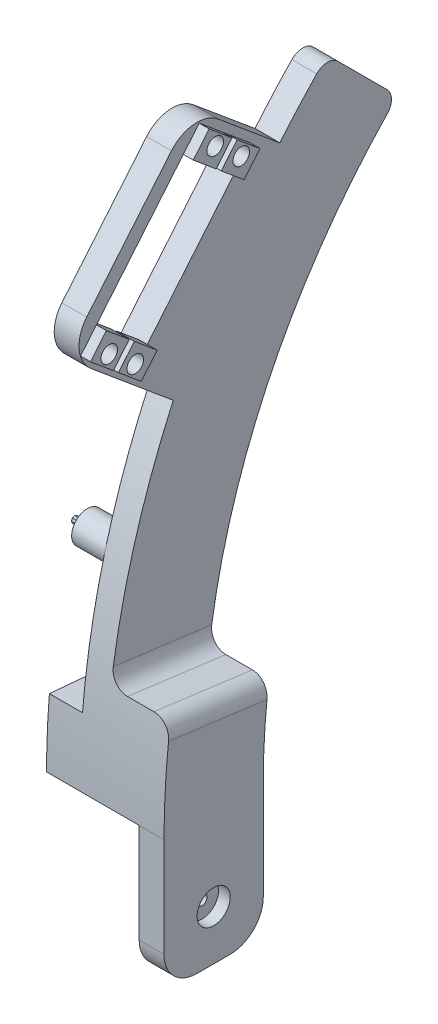
from build123d import *

# Parameters (mm, degrees)
CURVE_MAIN_BODY_DEPTH                = 35.5
CUT_EXTRUDE2_START                   = -18
CUT_EXTRUDE2_DEPTH                   = 18
CUT_EXTRUDE3_DEPTH                   = 10
FILLET3_R                            = 5
FILLET3_OF_MIRROR3_R                 = 5
SKETCH14_W                           = 7.5
SKETCH14_H                           = 30
BOSS_EXTRUDE9_DEPTH                  = 40
SKETCH17_R                           = 4.75
BOSS_EXTRUDE6_DEPTH                  = 20
SERVO_PLACEMENT_BODY_DEPTH           = 7.5
BOSS_EXTRUDE10_DEPTH                 = 27.5
CUT_EXTRUDE8_DEPTH                   = 211.213868042
CUT_EXTRUDE8_DEPTH_BACK              = 211.213868042
SKETCH29_W                           = 20
SKETCH29_H                           = 60
SKETCH21_W                           = 105.177079877
SKETCH21_H                           = 219.768987876
MAKE_HALF_DEPTH                      = 271.966391894
CHAMFER2_SIZE                        = 30
MALE_JACK_DEPTH                      = 4
MALE_JACK_CHAMFER_SIZE               = 0.2
SERVO_PLACEMENT_DEPTH                = 3
SKETCH36_R                           = 2.5
SERVO_HOLE_DEPTH                     = 270.745779446
SERVO_PLACEMENT_COMPLETION_DEPTH     = 5
BICEPS_CONNECTION_FILLET_R           = 10
BOW_CONNECTION_FILLET_R              = 4.5
SERVO_HOLE_FILLET_R                  = 10
SKETCH30_R                           = 4.5
FOREARM_SERVO_CONNECTION_OUTER_DEPTH = 2
SKETCH34_R                           = 1.5
FOREARM_SERVO_CONNECTION_INNER_DEPTH = 5.5
SKETCH38_R                           = 5
CUT_EXTRUDE14_DEPTH                  = 3.5
CUT_EXTRUDE15_DEPTH                  = 5


with BuildPart() as part:
    # Sketch2 → Curve Main Body (new body)
    with BuildSketch(Plane(origin=(0, 0, 0), x_dir=(0, 0, -1), z_dir=(1, 0, 0))):
        with BuildLine():
            Line((-197.17702304, 0), (-167.17702304, 0))
            ThreePointArc((-167.17702304, 0), (-151.952929542, 76.536686473), (-108.598379277, 141.421356237))
            Line((-108.598379277, 141.421356237), (-129.811582713, 162.634559673))
            ThreePointArc((-129.811582713, 162.634559673), (-179.669315518, 88.017189444), (-197.17702304, 0))
        make_face()
    curve_main_body = extrude(amount=CURVE_MAIN_BODY_DEPTH)

    # Sketch6 → Cut-Extrude2 (cut)
    with BuildSketch(Plane(origin=(35.5, 0, 0), x_dir=(0, 0, -1), z_dir=(1, 0, 0)).offset(CUT_EXTRUDE2_START)):
        with BuildLine():
            Line((-165.465995315, 26.105238444), (-195.209341156, 30.021024211))
            ThreePointArc((-195.209341156, 30.021024211), (-173.457753593, 101.72639875), (-129.811582713, 162.634559673))
            Line((-129.811582713, 162.634559673), (-108.598379277, 141.421356237))
            ThreePointArc((-108.598379277, 141.421356237), (-146.551571347, 88.457738044), (-165.465995315, 26.105238444))
        make_face()
    cut_extrude2 = extrude(amount=CUT_EXTRUDE2_DEPTH, mode=Mode.SUBTRACT)

    # Sketch7 → Cut-Extrude3 (cut)
    with BuildSketch(Plane.ZY):
        with BuildLine():
            Line((166.415962658, 17.43114855), (196.301803601, 20.045820832))
            ThreePointArc((196.301803601, 20.045820832), (175.627814058, 97.2022002), (129.811582713, 162.634559673))
            Line((129.811582713, 162.634559673), (108.598379277, 141.421356237))
            ThreePointArc((108.598379277, 141.421356237), (148.438580447, 84.523652348), (166.415962658, 17.43114855))
        make_face()
    cut_extrude3 = extrude(amount=-CUT_EXTRUDE3_DEPTH, mode=Mode.SUBTRACT)

    # Fillet3
    fillet3_edges = [part.edges().sort_by_distance(p)[0] for p in [
        (35.5, 28.063131327, 180.337668235),
        (17.5, 28.063131327, 180.337668235),
    ]]
    fillet(fillet3_edges, radius=FILLET3_R)

    # Mirror3: Curve Main Body, Cut-Extrude2, Cut-Extrude3 across plane
    add(curve_main_body.mirror(Plane(origin=(0, 0, -32.82297696), x_dir=(0, 0, 1), z_dir=(-1, 0, 0))))
    add(cut_extrude2.mirror(Plane(origin=(0, 0, -32.82297696), x_dir=(0, 0, 1), z_dir=(-1, 0, 0))), mode=Mode.SUBTRACT)
    add(cut_extrude3.mirror(Plane(origin=(0, 0, -32.82297696), x_dir=(0, 0, 1), z_dir=(-1, 0, 0))), mode=Mode.SUBTRACT)

    # Fillet3 of Mirror3
    fillet3_of_mirror3_edges = [part.edges().sort_by_distance(p)[0] for p in [
        (-35.5, 28.063131327, 180.337668235),
        (-17.5, 28.063131327, 180.337668235),
    ]]
    fillet(fillet3_of_mirror3_edges, radius=FILLET3_OF_MIRROR3_R)

    # Sketch14 → Boss-Extrude9 (add)
    with BuildSketch(Plane.XZ):
        with Locations((-31.75, 182.17702304)):
            Rectangle(SKETCH14_W, SKETCH14_H)
        with Locations((31.75, 182.17702304)):
            Rectangle(SKETCH14_W, SKETCH14_H)
    extrude(amount=BOSS_EXTRUDE9_DEPTH)

    # Sketch17 → Boss-Extrude6 (add)
    with BuildSketch(Plane(origin=(-10, 0, 0), x_dir=(0, 0, -1), z_dir=(1, 0, 0))):
        with Locations(Location((-115.276928512, 141.382391051, 0), (0, 0, 45))):
            Circle(SKETCH17_R)
        with Locations(Location((-184.833556277, 57.993068891, 0), (0, 0, 165.080977231))):
            Circle(SKETCH17_R)
    extrude(amount=BOSS_EXTRUDE6_DEPTH)

    # Sketch18 → Servo Placement Body (add)
    with BuildSketch(Plane(origin=(-10, 0, 0), x_dir=(0, 0, -1), z_dir=(1, 0, 0))):
        Polygon((-208.94151729, 122.761668275), (-162.866051375, 84.329241332), (-124.433624432, 130.404707247), (-170.509090347, 168.83713419), align=None)
    extrude(amount=-SERVO_PLACEMENT_BODY_DEPTH)

    # Sketch26 → Boss-Extrude10 (add)
    with BuildSketch(Plane(origin=(-10, 0, 0), x_dir=(0, 0, -1), z_dir=(1, 0, 0))):
        Polygon((-144.175864755, 146.872087312), (-170.509090347, 168.83713419), (-208.94151729, 122.761668275), (-176.370431585, 95.593503028), align=None)
    extrude(amount=BOSS_EXTRUDE10_DEPTH)

    # Sketch29 → Cut-Extrude8 (cut, two sides: drawn at the far end of the back side and taken through both)
    with BuildSketch(Plane(origin=(0, 153.143683779, 183.599297347), x_dir=(1, 0, 0), z_dir=(0, 0.640540449048381, 0.767924431915601)).offset(-CUT_EXTRUDE8_DEPTH_BACK)):
        with Locations((0, -9.563808939)):
            Rectangle(SKETCH29_W, SKETCH29_H)
    extrude(amount=CUT_EXTRUDE8_DEPTH + CUT_EXTRUDE8_DEPTH_BACK, mode=Mode.SUBTRACT)

    # Sketch21 → Make Half (cut, through all)
    with BuildSketch(Plane(origin=(0, 0, 0), x_dir=(0, 0, -1), z_dir=(1, 0, 0))):
        with Locations((-156.96960977, 61.310905927)):
            Rectangle(SKETCH21_W, SKETCH21_H)
    extrude(amount=-MAKE_HALF_DEPTH, mode=Mode.SUBTRACT)

    # Chamfer2
    # the kernel refuses this chamfer: 30, 19 mm, written as the material it takes off along each edge
    with BuildSketch(Plane(origin=(-77.551070811, 0, 167.17702304), x_dir=(0, 0, 1), z_dir=(1, 0, 0))) as chamfer2_piece_1:
        with BuildLine():
            Line((CHAMFER2_SIZE, 0), (-0.963738269, -19.610367571))
            ThreePointArc((-0.963738269, -19.610367571), (-0.258402539, -10.163377571), (0, 0))
            Line((0, 0), (CHAMFER2_SIZE, 0))
        make_face()
    extrude(amount=105.551070811, mode=Mode.SUBTRACT)

    # Sketch31 → Male Jack (add)
    with BuildSketch(Plane.ZY):
        Polygon((116.276928512, 141.382391051), (115.984035293, 142.089497832), (115.276928512, 142.382391051), (114.569821731, 142.089497832), (114.276928512, 141.382391051), (114.569821731, 140.675284269), (115.276928512, 140.382391051), (115.984035293, 140.675284269), align=None)
        Polygon((184.833556277, 58.993068891), (184.126449496, 58.700175672), (183.833556277, 57.993068891), (184.126449496, 57.285962109), (184.833556277, 56.993068891), (185.540663058, 57.285962109), (185.833556277, 57.993068891), (185.540663058, 58.700175672), align=None)
    extrude(amount=MALE_JACK_DEPTH)

    # Male Jack Chamfer
    male_jack_chamfer_edges = [part.edges().sort_by_distance(p)[0] for p in [
        (-4, 142.235944441, 115.630481903),
        (-4, 142.235944441, 114.923375121),
        (-4, 141.735944441, 114.423375121),
        (-4, 141.02883766, 114.423375121),
        (-4, 140.52883766, 114.923375121),
        (-4, 140.52883766, 115.630481903),
        (-4, 141.02883766, 116.130481903),
        (-4, 141.735944441, 116.130481903),
        (-4, 58.846622281, 185.187109667),
        (-4, 58.846622281, 184.480002886),
        (-4, 58.346622281, 183.980002886),
        (-4, 57.6395155, 183.980002886),
        (-4, 57.1395155, 184.480002886),
        (-4, 57.1395155, 185.187109667),
        (-4, 57.6395155, 185.687109667),
        (-4, 58.346622281, 185.687109667),
    ]]
    chamfer(male_jack_chamfer_edges, length=MALE_JACK_CHAMFER_SIZE)

    # Sketch35 → Servo Placement (add)
    with BuildSketch(Plane(origin=(17.5, 0, 0), x_dir=(0, 0, -1), z_dir=(1, 0, 0))):
        Polygon((-204.396938583, 121.184707789), (-189.038449945, 108.373898808), (-153.168184798, 151.377666995), (-168.526673437, 164.188475976), align=None)
    extrude(amount=SERVO_PLACEMENT_DEPTH)

    # Sketch36 → Servo Hole (cut, through all)
    with BuildSketch(Plane(origin=(20.5, 0, 0), x_dir=(0, 0, -1), z_dir=(1, 0, 0))):
        with Locations((-166.700823556, 158.758865289)):
            Circle(SKETCH36_R)
        with Locations(Location((-158.837277373, 152.199731091, 0), (0, 0, 180))):
            Circle(SKETCH36_R)
        with Locations((-190.864299826, 113.803509495)):
            Circle(SKETCH36_R)
        with Locations(Location((-198.727846008, 120.362643693, 0), (0, 0, 180))):
            Circle(SKETCH36_R)
        Polygon((-184.234396577, 114.133332047), (-157.972238166, 145.618233756), (-164.883558053, 151.383097797), (-160.079504686, 157.142531036), (-161.615353549, 158.423611935), (-166.419406917, 152.664178695), (-173.330726804, 158.429042737), (-199.592885215, 126.944141028), (-192.681565328, 121.179276987), (-197.485618696, 115.419843747), (-195.949769832, 114.138762849), (-191.145716464, 119.898196089), align=None)
    extrude(amount=-SERVO_HOLE_DEPTH, mode=Mode.SUBTRACT)

    # Sketch37 → Servo Placement Completion (cut)
    with BuildSketch(Plane.ZY.offset(-10)):
        Polygon((153.168184798, 151.377666995), (168.526673437, 164.188475976), (204.396938583, 121.184707789), (189.038449945, 108.373898808), align=None)
    extrude(amount=-SERVO_PLACEMENT_COMPLETION_DEPTH, mode=Mode.SUBTRACT)

    # Biceps Connection Fillet
    biceps_connection_fillet_edges = [part.edges().sort_by_distance(p)[0] for p in [
        (31.75, -40, 197.17702304),
        (31.75, -40, 167.17702304),
    ]]
    fillet(biceps_connection_fillet_edges, radius=BICEPS_CONNECTION_FILLET_R)

    # Bow Connection Fillet
    bow_connection_fillet_edges = [part.edges().sort_by_distance(p)[0] for p in [
        (13.75, 162.634559673, 129.811582713),
        (13.75, 141.421356237, 108.598379277),
    ]]
    fillet(bow_connection_fillet_edges, radius=BOW_CONNECTION_FILLET_R)

    # Servo Hole Fillet
    servo_hole_fillet_edges = [part.edges().sort_by_distance(p)[0] for p in [
        (13.75, 122.761668275, 208.94151729),
        (13.75, 168.83713419, 170.509090347),
    ]]
    fillet(servo_hole_fillet_edges, radius=SERVO_HOLE_FILLET_R)

    # Sketch30 → Forearm Servo Connection Outer (cut)
    with BuildSketch(Plane.ZY.offset(-28)):
        with Locations((182.17702304, -25)):
            Circle(SKETCH30_R)
    extrude(amount=-FOREARM_SERVO_CONNECTION_OUTER_DEPTH, mode=Mode.SUBTRACT)

    # Sketch34 → Forearm Servo Connection Inner (cut)
    with BuildSketch(Plane.ZY.offset(-30)):
        with Locations((182.17702304, -25)):
            Circle(SKETCH34_R)
    extrude(amount=-FOREARM_SERVO_CONNECTION_INNER_DEPTH, mode=Mode.SUBTRACT)

    # Sketch38 → Cut-Extrude14 (cut)
    with BuildSketch(Plane(origin=(35.5, 0, 0), x_dir=(0, 0, -1), z_dir=(1, 0, 0))):
        with Locations((-182.17702304, -25)):
            Circle(SKETCH38_R)
    extrude(amount=-CUT_EXTRUDE14_DEPTH, mode=Mode.SUBTRACT)

    # Sketch39 → Cut-Extrude15 (cut)
    with BuildSketch(Plane.ZY):
        Polygon((183.714801441, 14.018446755), (183.431679202, 14.729522163), (182.728675304, 15.032130751), (182.017599897, 14.749008512), (181.714991309, 14.046004614), (181.998113548, 13.334929206), (182.701117446, 13.032320619), (183.412192854, 13.315442858), align=None)
    extrude(amount=-CUT_EXTRUDE15_DEPTH, mode=Mode.SUBTRACT)


solid = part.part
